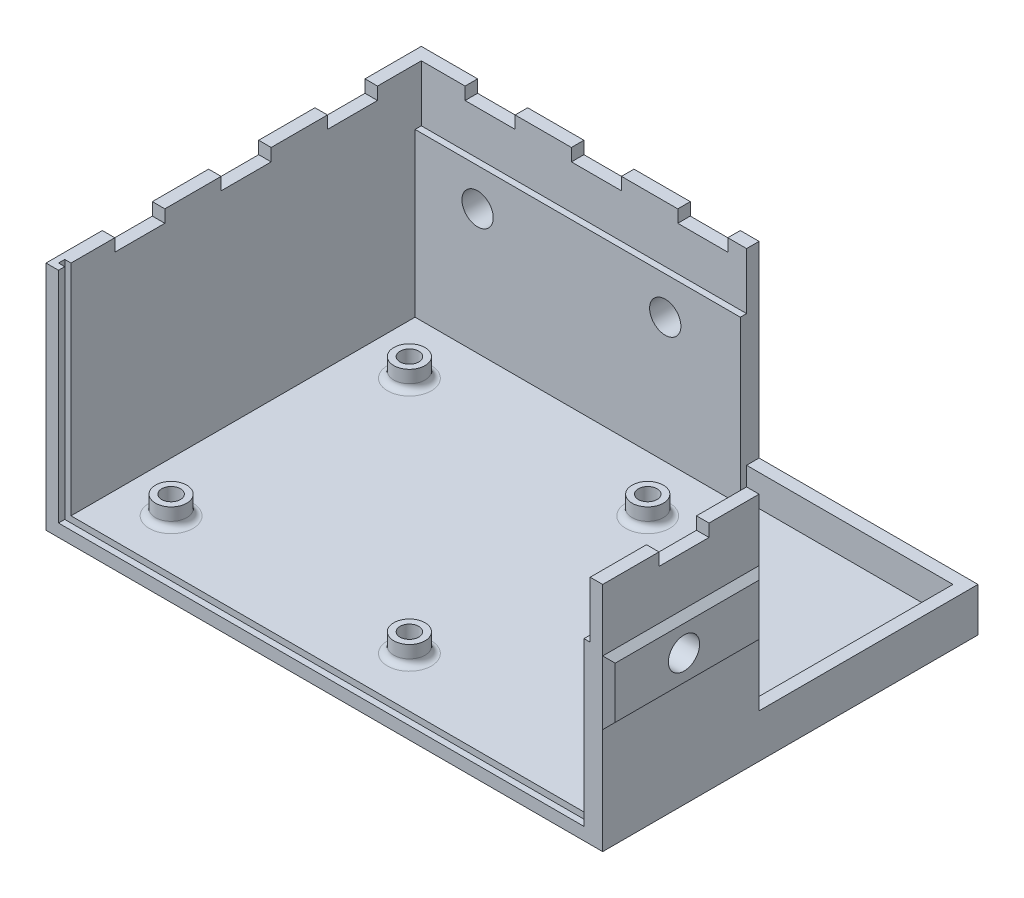
from build123d import *

# Parameters (mm, degrees)
SKETCH_449_W           = 89
SKETCH_449_H           = 60
EXTRUDE_502_DEPTH      = 2
SKETCH_552_R           = 2.5
EXTRUDE_809_DEPTH      = 3
FILLET_2_R             = 1
SKETCH_1002_R          = 1.5
CUT_EXTRUDE_1088_DEPTH = 108.452315005
EXTRUDE_1343_DEPTH     = 35
SKETCH_4_W             = 35
SKETCH_4_H             = 35
CUT_EXTRUDE_1580_DEPTH = 30
SKETCH_8_W             = 25
SKETCH_8_H             = 26
EXTRUDE_1831_DEPTH     = 1
SKETCH_1883_W          = 25
SKETCH_1883_H          = 10.2
EXTRUDE_2054_DEPTH     = 1
EXTRUDE_2054_TAPER     = 45
SKETCH_10_R            = 2.5
CUT_EXTRUDE_2296_DEPTH = 112.198021565
SKETCH_7_W             = 52
SKETCH_7_H             = 26.07500902
EXTRUDE_2536_DEPTH     = 1
SKETCH_2608_W          = 54
SKETCH_2608_H          = 10.2
EXTRUDE_2779_DEPTH     = 1
EXTRUDE_2779_TAPER     = 45
SKETCH_2841_R          = 2.5
CUT_EXTRUDE_3016_DEPTH = 113.774110634
SKETCH_3054_W          = 84
SKETCH_3054_H          = 1
CUT_EXTRUDE_3283_DEPTH = 1
SKETCH_3339_W          = 1
SKETCH_3339_H          = 36
CUT_EXTRUDE_3567_DEPTH = 1
SKETCH_3627_W          = 1
SKETCH_3627_H          = 27
CUT_EXTRUDE_3845_DEPTH = 1
SKETCH_26_W            = 2
SKETCH_26_H            = 8
CUT_EXTRUDE_4058_DEPTH = 2
SKETCH_4114_W          = 2
SKETCH_4114_H          = 8
SKETCH_4114_W_2        = 8
SKETCH_4114_H_2        = 2
CUT_EXTRUDE_4484_DEPTH = 2


with BuildPart() as part:
    # Sketch 449 → Extrude 502 (new body)
    with BuildSketch(Plane(origin=(0, 0, 0), x_dir=(1, 0, 0), z_dir=(0, 1, 0))):
        with Locations((44.5, 30)):
            Rectangle(SKETCH_449_W, SKETCH_449_H)
    extrude(amount=EXTRUDE_502_DEPTH)

    # Sketch 552 → Extrude 809 (add)
    with BuildSketch(Plane(origin=(0, 2, 0), x_dir=(1, 0, 0), z_dir=(0, 1, 0))):
        with Locations((10, 10)):
            Circle(SKETCH_552_R)
        with Locations((48.1, 10)):
            Circle(SKETCH_552_R)
        with Locations((48.1, 48.1)):
            Circle(SKETCH_552_R)
        with Locations((10, 48.1)):
            Circle(SKETCH_552_R)
    extrude(amount=EXTRUDE_809_DEPTH)

    # 圆角2
    fillet_2_edges = [part.edges().sort_by_distance(p)[0] for p in [
        (45.6, 2, -10),
        (45.6, 2, -48.1),
        (7.5, 2, -48.1),
        (7.5, 2, -10),
    ]]
    fillet(fillet_2_edges, radius=FILLET_2_R)

    # Sketch 1002 → Cut-Extrude 1088 (cut, through all)
    with BuildSketch(Plane(origin=(0, 5, 0), x_dir=(1, 0, 0), z_dir=(0, 1, 0))):
        with Locations((48.1, 10)):
            Circle(SKETCH_1002_R)
        with Locations((10, 10)):
            Circle(SKETCH_1002_R)
        with Locations((10, 48.1)):
            Circle(SKETCH_1002_R)
        with Locations((48.1, 48.1)):
            Circle(SKETCH_1002_R)
    extrude(amount=-CUT_EXTRUDE_1088_DEPTH, mode=Mode.SUBTRACT)

    # Sketch 1126 → Extrude 1343 (add)
    with BuildSketch(Plane(origin=(0, 2, 0), x_dir=(1, 0, 0), z_dir=(0, 1, 0))):
        Polygon((87, 0), (87, 58), (2, 58), (2, 0), (0, 0), (0, 60), (89, 60), (89, 0), align=None)
    extrude(amount=EXTRUDE_1343_DEPTH)

    # 草图4 → Cut-Extrude 1580 (cut)
    with BuildSketch(Plane(origin=(0, 37, 0), x_dir=(1, 0, 0), z_dir=(0, 1, 0))):
        with Locations((71.5, 42.5)):
            Rectangle(SKETCH_4_W, SKETCH_4_H)
    extrude(amount=-CUT_EXTRUDE_1580_DEPTH, mode=Mode.SUBTRACT)

    # 草图8 → Extrude 1831 (add)
    with BuildSketch(Plane.ZY.offset(-87)):
        with Locations((-12.5, 15)):
            Rectangle(SKETCH_8_W, SKETCH_8_H)
    extrude(amount=EXTRUDE_1831_DEPTH)

    # Sketch 1883 → Extrude 2054 (add)
    with BuildSketch(Plane(origin=(89, 0, 0), x_dir=(0, 0, -1), z_dir=(1, 0, 0))):
        with Locations((12.5, 22)):
            Rectangle(SKETCH_1883_W, SKETCH_1883_H)
    extrude(amount=EXTRUDE_2054_DEPTH, taper=EXTRUDE_2054_TAPER)

    # 草图10 → Cut-Extrude 2296 (cut, through all)
    with BuildSketch(Plane.ZY.offset(-86)):
        with Locations((-12, 22)):
            Circle(SKETCH_10_R)
    extrude(amount=-CUT_EXTRUDE_2296_DEPTH, mode=Mode.SUBTRACT)

    # 草图7 → Extrude 2536 (add)
    with BuildSketch(Plane.XY.offset(-58)):
        with Locations((28, 14.96249549)):
            Rectangle(SKETCH_7_W, SKETCH_7_H)
    extrude(amount=EXTRUDE_2536_DEPTH)

    # Sketch 2608 → Extrude 2779 (add)
    with BuildSketch(Plane(origin=(0, 0, -60), x_dir=(-1, 0, 0), z_dir=(0, 0, -1))):
        with Locations((-27, 22)):
            Rectangle(SKETCH_2608_W, SKETCH_2608_H)
    extrude(amount=EXTRUDE_2779_DEPTH, taper=EXTRUDE_2779_TAPER)

    # Sketch 2841 → Cut-Extrude 3016 (cut, through all)
    with BuildSketch(Plane.XY.offset(-57)):
        with Locations((12, 22)):
            Circle(SKETCH_2841_R)
        with Locations((42, 22)):
            Circle(SKETCH_2841_R)
    extrude(amount=-CUT_EXTRUDE_3016_DEPTH, mode=Mode.SUBTRACT)

    # Sketch 3054 → Cut-Extrude 3283 (cut)
    with BuildSketch(Plane(origin=(0, 2, 0), x_dir=(1, 0, 0), z_dir=(0, 1, 0))):
        with Locations((44, 1.5)):
            Rectangle(SKETCH_3054_W, SKETCH_3054_H)
    extrude(amount=-CUT_EXTRUDE_3283_DEPTH, mode=Mode.SUBTRACT)

    # Sketch 3339 → Cut-Extrude 3567 (cut)
    with BuildSketch(Plane(origin=(2, 0, 0), x_dir=(0, 0, -1), z_dir=(1, 0, 0))):
        with Locations((1.5, 19)):
            Rectangle(SKETCH_3339_W, SKETCH_3339_H)
    extrude(amount=-CUT_EXTRUDE_3567_DEPTH, mode=Mode.SUBTRACT)

    # Sketch 3627 → Cut-Extrude 3845 (cut)
    with BuildSketch(Plane.ZY.offset(-86)):
        with Locations((-1.5, 14.5)):
            Rectangle(SKETCH_3627_W, SKETCH_3627_H)
    extrude(amount=-CUT_EXTRUDE_3845_DEPTH, mode=Mode.SUBTRACT)

    # 草图26 → Cut-Extrude 4058 (cut)
    with BuildSketch(Plane(origin=(0, 37, 0), x_dir=(1, 0, 0), z_dir=(0, 1, 0))):
        with Locations((88, 13)):
            Rectangle(SKETCH_26_W, SKETCH_26_H)
    extrude(amount=-CUT_EXTRUDE_4058_DEPTH, mode=Mode.SUBTRACT)

    # Sketch 4114 → Cut-Extrude 4484 (cut)
    with BuildSketch(Plane(origin=(0, 37, 0), x_dir=(1, 0, 0), z_dir=(0, 1, 0))):
        with Locations((1, 13)):
            Rectangle(SKETCH_4114_W, SKETCH_4114_H)
        with Locations((1, 30)):
            Rectangle(SKETCH_4114_W, SKETCH_4114_H)
        with Locations((1, 47)):
            Rectangle(SKETCH_4114_W, SKETCH_4114_H)
        with Locations((13, 59)):
            Rectangle(SKETCH_4114_W_2, SKETCH_4114_H_2)
        with Locations((30, 59)):
            Rectangle(SKETCH_4114_W_2, SKETCH_4114_H_2)
        with Locations((47, 59)):
            Rectangle(SKETCH_4114_W_2, SKETCH_4114_H_2)
    extrude(amount=-CUT_EXTRUDE_4484_DEPTH, mode=Mode.SUBTRACT)


solid = part.part
